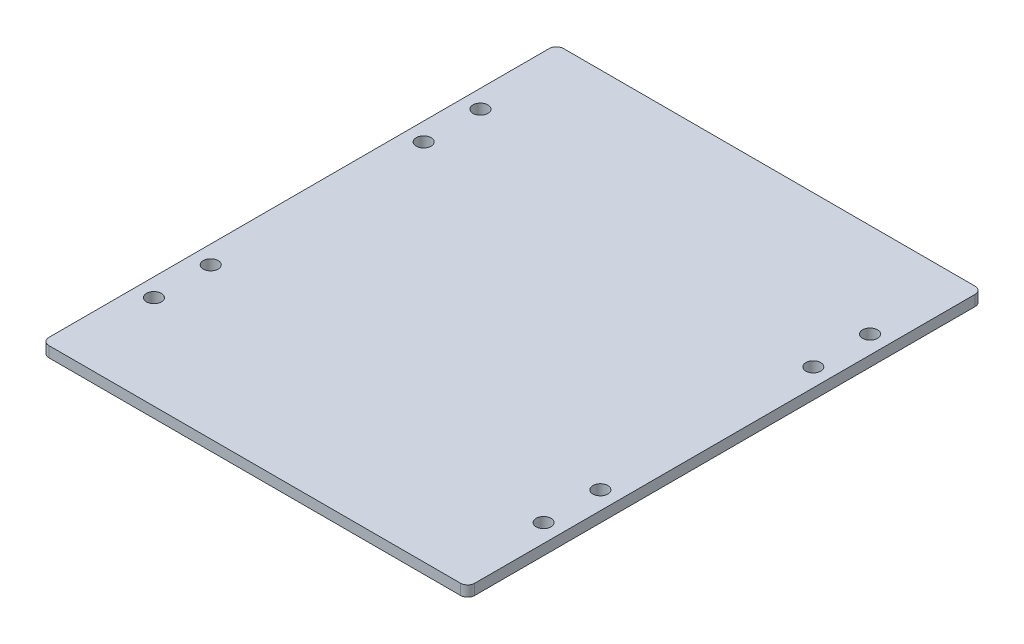
from build123d import *

# Parameters (mm, degrees)
SKETCH1_W           = 120
SKETCH1_H           = 145
BOSS_EXTRUDE1_DEPTH = 3
SKETCH2_R           = 2.1
CUT_EXTRUDE1_DEPTH  = 191.559701931
FILLET1_R           = 2


with BuildPart() as part:
    # Sketch1 → Boss-Extrude1 (new body)
    with BuildSketch(Plane(origin=(0, 0, 0), x_dir=(1, 0, 0), z_dir=(0, 1, 0))):
        with Locations((60, 72.5)):
            Rectangle(SKETCH1_W, SKETCH1_H)
    extrude(amount=BOSS_EXTRUDE1_DEPTH)

    # Sketch2 → Cut-Extrude1 (cut, through all)
    with BuildSketch(Plane(origin=(0, 3, 3), x_dir=(1, 0, 0), z_dir=(0, 1, 0))):
        with Locations((5.1, 121.5)):
            Circle(SKETCH2_R)
        with Locations((5.1, 105.5)):
            Circle(SKETCH2_R)
        with Locations((5.1, 45.5)):
            Circle(SKETCH2_R)
        with Locations((5.1, 29.5)):
            Circle(SKETCH2_R)
        with Locations((114.9, 29.5)):
            Circle(SKETCH2_R)
        with Locations((114.9, 45.5)):
            Circle(SKETCH2_R)
        with Locations((114.9, 105.5)):
            Circle(SKETCH2_R)
        with Locations((114.9, 121.5)):
            Circle(SKETCH2_R)
    extrude(amount=-CUT_EXTRUDE1_DEPTH, mode=Mode.SUBTRACT)

    # Fillet1
    fillet1_edges = [part.edges().sort_by_distance(p)[0] for p in [
        (0, 1.5, -145),
        (120, 1.5, -145),
        (120, 1.5, 0),
        (0, 1.5, 0),
    ]]
    fillet(fillet1_edges, radius=FILLET1_R)


solid = part.part
